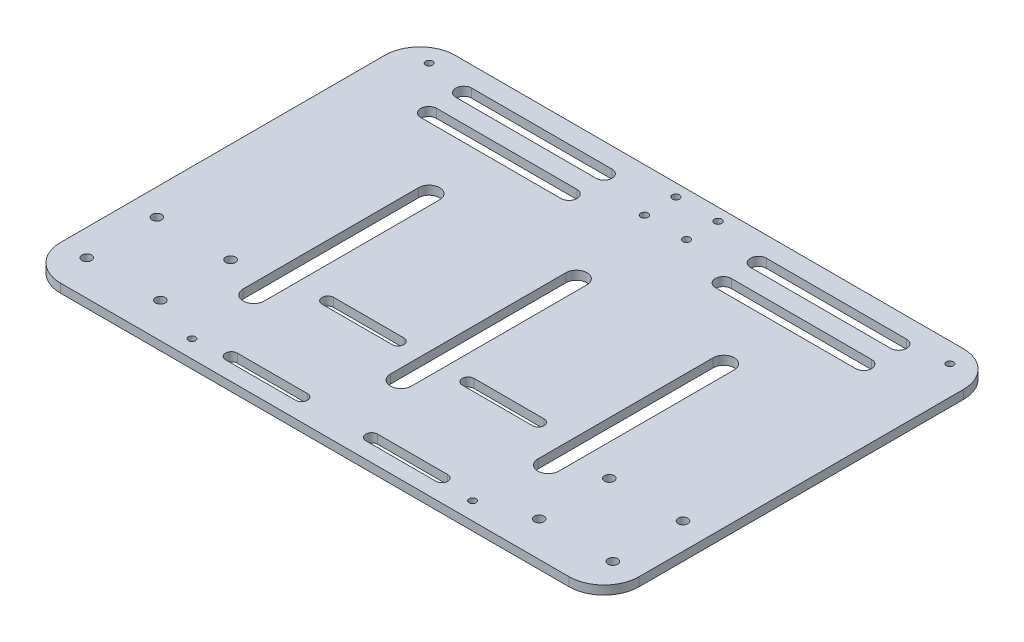
from build123d import *

# Parameters (mm, degrees)
SKETCH_1_W          = 330
SKETCH_1_H          = 225
EXTRUDE_1_DEPTH     = 5
SKETCH_2_R          = 2.1
CUT_EXTRUDE_1_DEPTH = 395.101001153
SKETCH_3_R          = 2.75
CUT_EXTRUDE_2_DEPTH = 395.101001153
CUT_EXTRUDE_4_DEPTH = 395.101001153
SKETCH_6_R          = 2
CUT_EXTRUDE_5_DEPTH = 395.101001153
FILLET_1_R          = 20


with BuildPart() as part:
    # 草图1 → 凸台-拉伸1 (new body)
    with BuildSketch(Plane(origin=(0, 0, 0), x_dir=(1, 0, 0), z_dir=(0, 1, 0))):
        with Locations((149.701456311, 124.678398058)):
            Rectangle(SKETCH_1_W, SKETCH_1_H)
    extrude(amount=EXTRUDE_1_DEPTH)

    # 草图2 → 切除-拉伸1 (cut, through all)
    with BuildSketch(Plane(origin=(0, 5, 0), x_dir=(1, 0, 0), z_dir=(0, 1, 0))):
        with Locations((137.701456311, 230.178398058)):
            Circle(SKETCH_2_R)
        with Locations((161.701456311, 230.178398058)):
            Circle(SKETCH_2_R)
        with Locations((137.701456311, 212.178398058)):
            Circle(SKETCH_2_R)
        with Locations((161.701456311, 212.178398058)):
            Circle(SKETCH_2_R)
        with BuildLine():
            Line((25.701456311, 225.715369926), (105.701456311, 225.715369926))
            ThreePointArc((105.701456311, 225.715369926), (110.238428179, 221.178398058), (105.701456311, 216.64142619))
            Line((105.701456311, 216.64142619), (25.701456311, 216.64142619))
            ThreePointArc((25.701456311, 216.64142619), (21.164484443, 221.178398058), (25.701456311, 225.715369926))
        make_face()
        with BuildLine():
            Line((273.701456311, 225.715369926), (193.701456311, 225.715369926))
            ThreePointArc((193.701456311, 225.715369926), (189.164484443, 221.178398058), (193.701456311, 216.64142619))
            Line((193.701456311, 216.64142619), (273.701456311, 216.64142619))
            ThreePointArc((273.701456311, 216.64142619), (278.238428179, 221.178398058), (273.701456311, 225.715369926))
        make_face()
        with BuildLine():
            Line((25.701456311, 205.715369926), (105.701456311, 205.715369926))
            ThreePointArc((105.701456311, 205.715369926), (110.238428179, 201.178398058), (105.701456311, 196.64142619))
            Line((105.701456311, 196.64142619), (25.701456311, 196.64142619))
            ThreePointArc((25.701456311, 196.64142619), (21.164484443, 201.178398058), (25.701456311, 205.715369926))
        make_face()
        with BuildLine():
            Line((273.701456311, 205.715369926), (193.701456311, 205.715369926))
            ThreePointArc((193.701456311, 205.715369926), (189.164484443, 201.178398058), (193.701456311, 196.64142619))
            Line((193.701456311, 196.64142619), (273.701456311, 196.64142619))
            ThreePointArc((273.701456311, 196.64142619), (278.238428179, 201.178398058), (273.701456311, 205.715369926))
        make_face()
    extrude(amount=-CUT_EXTRUDE_1_DEPTH, mode=Mode.SUBTRACT)

    # 草图3 → 切除-拉伸2 (cut, through all)
    with BuildSketch(Plane(origin=(0, 5, 0), x_dir=(1, 0, 0), z_dir=(0, 1, 0))):
        with Locations((-0.298543689, 32.178398058)):
            Circle(SKETCH_3_R)
        with Locations((-0.298543689, 72.178398058)):
            Circle(SKETCH_3_R)
        with Locations((41.701456311, 32.178398058)):
            Circle(SKETCH_3_R)
        with Locations((41.701456311, 72.178398058)):
            Circle(SKETCH_3_R)
        with Locations((257.701456311, 72.178398058)):
            Circle(SKETCH_3_R)
        with Locations((257.701456311, 32.178398058)):
            Circle(SKETCH_3_R)
        with Locations((299.701456311, 72.178398058)):
            Circle(SKETCH_3_R)
        with Locations((299.701456311, 32.178398058)):
            Circle(SKETCH_3_R)
        with BuildLine():
            Line((89.701456311, 83.007563115), (129.701456311, 83.007563115))
            ThreePointArc((129.701456311, 83.007563115), (133.030621367, 79.678398058), (129.701456311, 76.349233002))
            Line((129.701456311, 76.349233002), (89.701456311, 76.349233002))
            ThreePointArc((89.701456311, 76.349233002), (86.372291254, 79.678398058), (89.701456311, 83.007563115))
        make_face()
        with BuildLine():
            Line((209.701456311, 83.007563115), (169.701456311, 83.007563115))
            ThreePointArc((169.701456311, 83.007563115), (166.372291254, 79.678398058), (169.701456311, 76.349233002))
            Line((169.701456311, 76.349233002), (209.701456311, 76.349233002))
            ThreePointArc((209.701456311, 76.349233002), (213.030621367, 79.678398058), (209.701456311, 83.007563115))
        make_face()
        with BuildLine():
            Line((89.701456311, 21.349233002), (129.701456311, 21.349233002))
            ThreePointArc((129.701456311, 21.349233002), (133.030621367, 24.678398058), (129.701456311, 28.007563115))
            Line((129.701456311, 28.007563115), (89.701456311, 28.007563115))
            ThreePointArc((89.701456311, 28.007563115), (86.372291254, 24.678398058), (89.701456311, 21.349233002))
        make_face()
        with BuildLine():
            Line((209.701456311, 21.349233002), (169.701456311, 21.349233002))
            ThreePointArc((169.701456311, 21.349233002), (166.372291254, 24.678398058), (169.701456311, 28.007563115))
            Line((169.701456311, 28.007563115), (209.701456311, 28.007563115))
            ThreePointArc((209.701456311, 28.007563115), (213.030621367, 24.678398058), (209.701456311, 21.349233002))
        make_face()
    extrude(amount=-CUT_EXTRUDE_2_DEPTH, mode=Mode.SUBTRACT)

    # 草图5 → 切除-拉伸4 (cut, through all)
    with BuildSketch(Plane(origin=(0, 5, 0), x_dir=(1, 0, 0), z_dir=(0, 1, 0))):
        with BuildLine():
            Line((155.701456311, 161.411602286), (155.701456311, 61.411602286))
            ThreePointArc((155.701456311, 61.411602286), (149.701456311, 55.411602286), (143.701456311, 61.411602286))
            Line((143.701456311, 61.411602286), (143.701456311, 161.411602286))
            ThreePointArc((143.701456311, 161.411602286), (149.701456311, 167.411602286), (155.701456311, 161.411602286))
        make_face()
        with BuildLine():
            Line((239.701456311, 161.411602286), (239.701456311, 61.411602286))
            ThreePointArc((239.701456311, 61.411602286), (233.701456311, 55.411602286), (227.701456311, 61.411602286))
            Line((227.701456311, 61.411602286), (227.701456311, 161.411602286))
            ThreePointArc((227.701456311, 161.411602286), (233.701456311, 167.411602286), (239.701456311, 161.411602286))
        make_face()
        with BuildLine():
            Line((59.701456311, 161.411602286), (59.701456311, 61.411602286))
            ThreePointArc((59.701456311, 61.411602286), (65.701456311, 55.411602286), (71.701456311, 61.411602286))
            Line((71.701456311, 61.411602286), (71.701456311, 161.411602286))
            ThreePointArc((71.701456311, 161.411602286), (65.701456311, 167.411602286), (59.701456311, 161.411602286))
        make_face()
    extrude(amount=-CUT_EXTRUDE_4_DEPTH, mode=Mode.SUBTRACT)

    # 草图6 → 切除-拉伸5 (cut, through all)
    with BuildSketch(Plane(origin=(0, 5, 0), x_dir=(1, 0, 0), z_dir=(0, 1, 0))):
        with Locations((1.226003167, 225.911661565)):
            Circle(SKETCH_6_R)
        with Locations((298.176909455, 225.911661565)):
            Circle(SKETCH_6_R)
        with Locations((69.701456311, 22.178398058)):
            Circle(SKETCH_6_R)
        with Locations((229.701456311, 22.178398058)):
            Circle(SKETCH_6_R)
    extrude(amount=-CUT_EXTRUDE_5_DEPTH, mode=Mode.SUBTRACT)

    # 圆角1
    fillet_1_edges = [part.edges().sort_by_distance(p)[0] for p in [
        (314.701456311, 2.5, -12.178398058),
        (314.701456311, 2.5, -237.178398058),
        (-15.298543689, 2.5, -237.178398058),
        (-15.298543689, 2.5, -12.178398058),
    ]]
    fillet(fillet_1_edges, radius=FILLET_1_R)


solid = part.part
